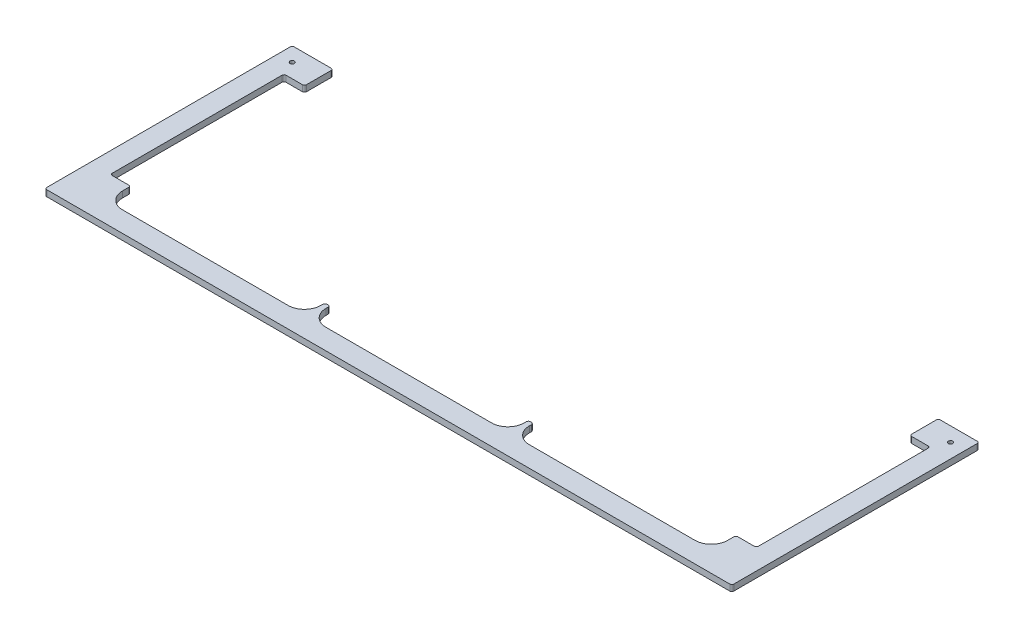
from build123d import *

# Parameters (mm, degrees)
SKETCH1_R           = 3.3734375
BOSS_EXTRUDE1_DEPTH = 9.525


with BuildPart() as part:
    # Sketch1 → Boss-Extrude1 (new body)
    with BuildSketch(Plane(origin=(0, 0, 0), x_dir=(1, 0, 0), z_dir=(0, 1, 0))):
        with BuildLine():
            Line((1006.475, 384.175), (1063.625, 384.175))
            ThreePointArc((1063.625, 384.175), (1065.87006403, 383.24506403), (1066.8, 381))
            Line((1066.8, 381), (1066.8, 3.175))
            ThreePointArc((1066.8, 3.175), (1065.87006403, 0.92993597), (1063.625, 0))
            Line((1063.625, 0), (3.175, 0))
            ThreePointArc((3.175, 0), (0.92993597, 0.92993597), (0, 3.175))
            Line((0, 3.175), (0, 381))
            ThreePointArc((0, 381), (0.92993597, 383.24506403), (3.175, 384.175))
            Line((3.175, 384.175), (60.325, 384.175))
            ThreePointArc((60.325, 384.175), (62.57006403, 383.24506403), (63.5, 381))
            Line((63.5, 381), (63.5, 342.9))
            ThreePointArc((63.5, 342.9), (62.57006403, 340.65493597), (60.325, 339.725))
            Line((60.325, 339.725), (34.925, 339.725))
            ThreePointArc((34.925, 339.725), (32.67993597, 338.79506403), (31.75, 336.55))
            Line((31.75, 336.55), (31.75, 73.025))
            ThreePointArc((31.75, 73.025), (32.67993597, 70.77993597), (34.925, 69.85))
            Line((34.925, 69.85), (60.325, 69.85))
            ThreePointArc((60.325, 69.85), (62.57006403, 68.92006403), (63.5, 66.675))
            Line((63.5, 66.675), (63.5, 57.15))
            ThreePointArc((63.5, 57.15), (70.939487758, 39.189487758), (88.9, 31.75))
            Line((88.9, 31.75), (346.075, 31.75))
            ThreePointArc((346.075, 31.75), (364.035512242, 39.189487758), (371.475, 57.15))
            Line((371.475, 57.15), (371.475, 60.325))
            ThreePointArc((371.475, 60.325), (372.40493597, 62.57006403), (374.65, 63.5))
            Line((374.65, 63.5), (376.2375, 63.5))
            ThreePointArc((376.2375, 63.5), (378.48256403, 62.57006403), (379.4125, 60.325))
            Line((379.4125, 60.325), (379.4125, 57.15))
            ThreePointArc((379.4125, 57.15), (386.851987758, 39.189487758), (404.8125, 31.75))
            Line((404.8125, 31.75), (661.9875, 31.75))
            ThreePointArc((661.9875, 31.75), (679.948012242, 39.189487758), (687.3875, 57.15))
            Line((687.3875, 57.15), (687.3875, 60.325))
            ThreePointArc((687.3875, 60.325), (688.31743597, 62.57006403), (690.5625, 63.5))
            Line((690.5625, 63.5), (692.15, 63.5))
            ThreePointArc((692.15, 63.5), (694.39506403, 62.57006403), (695.325, 60.325))
            Line((695.325, 60.325), (695.325, 57.15))
            ThreePointArc((695.325, 57.15), (702.764487758, 39.189487758), (720.725, 31.75))
            Line((720.725, 31.75), (977.9, 31.75))
            ThreePointArc((977.9, 31.75), (995.860512242, 39.189487758), (1003.3, 57.15))
            Line((1003.3, 57.15), (1003.3, 66.675))
            ThreePointArc((1003.3, 66.675), (1004.22993597, 68.92006403), (1006.475, 69.85))
            Line((1006.475, 69.85), (1031.875, 69.85))
            ThreePointArc((1031.875, 69.85), (1034.12006403, 70.77993597), (1035.05, 73.025))
            Line((1035.05, 73.025), (1035.05, 336.55))
            ThreePointArc((1035.05, 336.55), (1034.12006403, 338.79506403), (1031.875, 339.725))
            Line((1031.875, 339.725), (1006.475, 339.725))
            ThreePointArc((1006.475, 339.725), (1004.22993597, 340.65493597), (1003.3, 342.9))
            Line((1003.3, 342.9), (1003.3, 381))
            ThreePointArc((1003.3, 381), (1004.22993597, 383.24506403), (1006.475, 384.175))
        make_face()
        with Locations((22.225, 361.95)):
            Circle(SKETCH1_R, mode=Mode.SUBTRACT)
        with Locations((1044.575, 361.95)):
            Circle(SKETCH1_R, mode=Mode.SUBTRACT)
    extrude(amount=BOSS_EXTRUDE1_DEPTH)


solid = part.part
